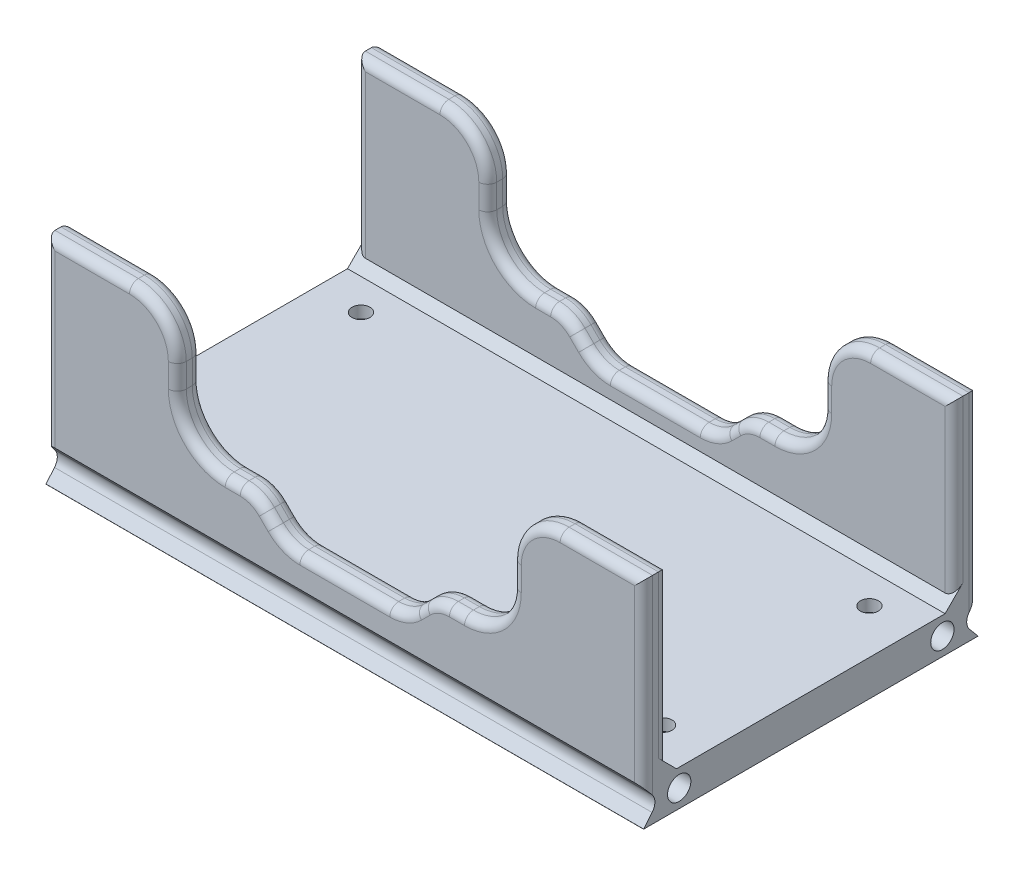
from build123d import *

# Parameters (mm, degrees)
SZKIC1_W                    = 99.9
SZKIC1_H                    = 55.9
DODANIE_WYCI_GNI_CIE1_DEPTH = 6
SZKIC2_R                    = 1.5
WYTNIJ_WYCI_GNI_CIE1_DEPTH  = 58.551759313
SZKIC3_R                    = 3.5
WYTNIJ_WYCI_GNI_CIE2_DEPTH  = 4
WYTNIJ_WYCI_GNI_CIE6_DEPTH  = 104.909636223
ZAOKR_GLENIE3_R             = 2
ZAOKR_GLENIE3_OF_LUSTRO2_R  = 2
SZKIC6_R                    = 2
WYTNIJ_WYCI_GNI_CIE3_DEPTH  = 1
ZAOKR_GLENIE2_R             = 2
SZKIC9_W                    = 99.9
SZKIC9_H                    = 4
DODANIE_WYCI_GNI_CIE2_DEPTH = 30
SFAZOWANIE2_SIZE            = 1.5
WYTNIJ_WYCI_GNI_CIE8_REACH  = 85.161
SZKIC10_W                   = 56
SZKIC10_H                   = 20
SZYK_KO_OWY1_COUNT          = 2
ZAOKR_GLENIE4_R             = 8
WYTNIJ_WYCI_GNI_CIE9_DEPTH  = 84.161364286
ZAOKR_GLENIE5_R             = 6
SFAZOWANIE3_SIZE            = 2
SZKIC7_R                    = 1.95
WYTNIJ_WYCI_GNI_CIE7_DEPTH  = 5.8
ZAOKR_GLENIE6_R             = 1.5


# Some blends are built 0.0001 mm under size
with BuildPart() as part:
    # Szkic1 → Dodanie-wyciągnięcie1 (new body)
    with BuildSketch(Plane(origin=(0, 0, 0), x_dir=(1, 0, 0), z_dir=(0, 1, 0))):
        Rectangle(SZKIC1_W, SZKIC1_H)
    extrude(amount=DODANIE_WYCI_GNI_CIE1_DEPTH)

    # Szkic2 → Wytnij-wyciągnięcie1 (cut, through all)
    with BuildSketch(Plane(origin=(0, 6, 0), x_dir=(1, 0, 0), z_dir=(0, 1, 0))):
        with Locations(Location((-42.5, 17.25, 0), (0, 0, 270))):
            Circle(SZKIC2_R)
        with Locations(Location((-42.5, -17.25, 0), (0, 0, 270))):
            Circle(SZKIC2_R)
        with Locations(Location((42.5, -17.25, 0), (0, 0, 270))):
            Circle(SZKIC2_R)
        with Locations(Location((42.5, 17.25, 0), (0, 0, 270))):
            Circle(SZKIC2_R)
    extrude(amount=-WYTNIJ_WYCI_GNI_CIE1_DEPTH, mode=Mode.SUBTRACT)

    # Szkic3 → Wytnij-wyciągnięcie2 (cut)
    with BuildSketch(Plane.XZ):
        with Locations(Location((-42.5, 17.25, 0), (0, 0, 270))):
            Circle(SZKIC3_R)
        with Locations(Location((-42.5, -17.25, 0), (0, 0, 270))):
            Circle(SZKIC3_R)
        with Locations(Location((42.5, 17.25, 0), (0, 0, 270))):
            Circle(SZKIC3_R)
        with Locations(Location((42.5, -17.25, 0), (0, 0, 270))):
            Circle(SZKIC3_R)
    extrude(amount=-WYTNIJ_WYCI_GNI_CIE2_DEPTH, mode=Mode.SUBTRACT)

    # Szkic5 → Wytnij-wyciągnięcie6 (cut, through all)
    with BuildSketch(Plane.ZY.offset(49.95)):
        Polygon((-27.95, 0.020616019), (-27.95, 5.979383981), (-25.45, 3), align=None)
    wytnij_wyci_gni_cie6 = extrude(amount=-WYTNIJ_WYCI_GNI_CIE6_DEPTH, mode=Mode.SUBTRACT)

    # Zaokrąglenie3
    zaokr_glenie3_edges = [part.edges().sort_by_distance(p)[0] for p in [
        (0, 3, -25.45),
    ]]
    fillet(zaokr_glenie3_edges, radius=ZAOKR_GLENIE3_R)

    # Lustro2: Wytnij-wyciągnięcie6 across plane
    add(wytnij_wyci_gni_cie6.mirror(Plane.XY), mode=Mode.SUBTRACT)

    # Zaokrąglenie3 of Lustro2
    zaokr_glenie3_of_lustro2_edges = [part.edges().sort_by_distance(p)[0] for p in [
        (0, 3, 25.45),
    ]]
    fillet(zaokr_glenie3_of_lustro2_edges, radius=ZAOKR_GLENIE3_OF_LUSTRO2_R)

    # Szkic6 → Wytnij-wyciągnięcie3 (cut)
    with BuildSketch(Plane.ZY.offset(49.95)):
        with Locations((0, 3)):
            Circle(SZKIC6_R)
    extrude(amount=-WYTNIJ_WYCI_GNI_CIE3_DEPTH, mode=Mode.SUBTRACT)

    # Zaokrąglenie2
    # the kernel refuses this fillet: 2 mm, written as the material it adds along each edge
    with BuildSketch(Plane(origin=(-48.95, 3, 0), x_dir=(0, 0, 1), z_dir=(0, -1, 0))) as zaokr_glenie2_piece_1:
        with BuildLine():
            CenterArc((0.267949192, 2), ZAOKR_GLENIE2_R, 270, 60)
            Line((0.267949192, 0), (0.267949192, -0.04))
            Line((0.267949192, -0.04), (2, -0.04))
            Line((2, -0.04), (2.04, 0))
            ThreePointArc((2.04, 0), (2.04, 0.5), (2.034641016, 0.98))
            Line((2.034641016, 0.98), (2, 1))
        make_face()
    revolve(axis=Axis((-48.95, 3, 0), (-1, 0, 0)))

    # Szkic9 → Dodanie-wyciągnięcie2 (add)
    with BuildSketch(Plane(origin=(0, 6, 0), x_dir=(1, 0, 0), z_dir=(0, 1, 0))):
        with Locations((0, 25.95)):
            Rectangle(SZKIC9_W, SZKIC9_H)
        with Locations((0, -25.95)):
            Rectangle(SZKIC9_W, SZKIC9_H)
    extrude(amount=DODANIE_WYCI_GNI_CIE2_DEPTH)

    # Sfazowanie2
    sfazowanie2_edges = [part.edges().sort_by_distance(p)[0] for p in [
        (0, 6, -23.95),
        (0, 6, 23.95),
    ]]
    chamfer(sfazowanie2_edges, length=SFAZOWANIE2_SIZE)

    # Szkic10 → Wytnij-wyciągnięcie8 (cut, up to next)
    with BuildSketch(Plane(origin=(0, 0, 27.95), x_dir=(-1, 0, 0), z_dir=(0, 0, -1)), mode=Mode.PRIVATE) as wytnij_wyci_gni_cie8_sk1:
        with Locations((0, 26)):
            Rectangle(SZKIC10_W, SZKIC10_H)
    wytnij_wyci_gni_cie8_tool1 = extrude(wytnij_wyci_gni_cie8_sk1.sketch, amount=WYTNIJ_WYCI_GNI_CIE8_REACH, mode=Mode.PRIVATE) & part.part
    wytnij_wyci_gni_cie8 = wytnij_wyci_gni_cie8_tool1.solids().sort_by_distance((0, 26, 27.95))[0]
    add(wytnij_wyci_gni_cie8, mode=Mode.SUBTRACT)

    # Szyk kołowy1: Wytnij-wyciągnięcie8 ×2 about axis
    szyk_ko_owy1_axis = Axis((0, -1.3, 0), (0, 1, 0))
    for i in range(1, SZYK_KO_OWY1_COUNT):
        add(wytnij_wyci_gni_cie8.rotate(szyk_ko_owy1_axis, i * 360 / SZYK_KO_OWY1_COUNT), mode=Mode.SUBTRACT)

    # Zaokrąglenie4
    zaokr_glenie4_edges = [part.edges().sort_by_distance(p)[0] for p in [
        (28, 36, 25.95),
        (-28, 36, 25.95),
        (-28, 16, 25.95),
        (28, 16, 25.95),
        (-28, 16, -25.95),
        (28, 16, -25.95),
        (28, 36, -25.95),
        (-28, 36, -25.95),
    ]]
    fillet(zaokr_glenie4_edges, radius=ZAOKR_GLENIE4_R)

    # Szkic11 → Wytnij-wyciągnięcie9 (cut, through all)
    with BuildSketch(Plane(origin=(0, 0, -27.95), x_dir=(-1, 0, 0), z_dir=(0, 0, -1))):
        Polygon((-10, 11), (10, 11), (15, 16), (-15, 16), align=None)
    extrude(amount=-WYTNIJ_WYCI_GNI_CIE9_DEPTH, mode=Mode.SUBTRACT)

    # Zaokrąglenie5
    zaokr_glenie5_edges = [part.edges().sort_by_distance(p)[0] for p in [
        (15, 16, -25.95),
        (-15, 16, -25.95),
        (-10, 11, -25.95),
        (-10, 11, 25.95),
        (15, 16, 25.95),
        (-15, 16, 25.95),
        (10, 11, -25.95),
        (10, 11, 25.95),
    ]]
    fillet(zaokr_glenie5_edges, radius=ZAOKR_GLENIE5_R)

    # Sfazowanie3
    sfazowanie3_edges = [part.edges().sort_by_distance(p)[0] for p in [
        (-42.5, 4, -13.75),
        (42.5, 4, 20.75),
        (42.5, 4, -13.75),
        (-42.5, 4, 20.75),
    ]]
    chamfer(sfazowanie3_edges, length=SFAZOWANIE3_SIZE - 0.0001)  # a hair under: the kernel refuses the full size

    # Szkic7 → Wytnij-wyciągnięcie7 (cut)
    with BuildSketch(Plane(origin=(49.95, 0, 0), x_dir=(0, 0, -1), z_dir=(1, 0, 0))):
        with Locations((-22, 3)):
            Circle(SZKIC7_R)
        with Locations(Location((22, 3, 0), (0, 0, 211.461356155))):
            Circle(SZKIC7_R)
    extrude(amount=-WYTNIJ_WYCI_GNI_CIE7_DEPTH, mode=Mode.SUBTRACT)

    # Zaokrąglenie6
    zaokr_glenie6_edges = [part.edges().sort_by_distance(p)[0] for p in [
        (49.95, 21.75, -23.95),
        (-49.95, 21.75, -23.95),
        (42.975, 36, -27.95),
        (-42.975, 36, -23.95),
        (49.95, 21.75, 23.95),
        (-49.95, 21.75, 23.95),
        (42.975, 36, 23.95),
        (-42.975, 36, 27.95),
        (-28, 26, -27.95),
        (-28, 26, -23.95),
        (-18.742640687, 16, -27.95),
        (18.742640687, 16, -23.95),
        (-42.975, 36, -27.95),
        (28, 26, -27.95),
        (30.343145751, 33.656854249, -27.95),
        (-30.343145751, 33.656854249, -27.95),
        (28, 26, -23.95),
        (42.975, 36, -23.95),
        (30.343145751, 33.656854249, -23.95),
        (-30.343145751, 33.656854249, -23.95),
        (18.742640687, 16, 27.95),
        (-18.742640687, 16, 23.95),
        (-28, 26, 27.95),
        (-28, 26, 23.95),
        (28, 26, 27.95),
        (28, 26, 23.95),
        (42.975, 36, 27.95),
        (-30.343145751, 33.656854249, 27.95),
        (30.343145751, 33.656854249, 27.95),
        (-42.975, 36, 23.95),
        (-30.343145751, 33.656854249, 23.95),
        (30.343145751, 33.656854249, 23.95),
        (-25.656854249, 18.343145751, -27.95),
        (-25.656854249, 18.343145751, -23.95),
        (25.656854249, 18.343145751, -27.95),
        (25.656854249, 18.343145751, -23.95),
        (-25.656854249, 18.343145751, 27.95),
        (-25.656854249, 18.343145751, 23.95),
        (25.656854249, 18.343145751, 27.95),
        (25.656854249, 18.343145751, 23.95),
        (0, 11, 27.95),
        (0, 11, 23.95),
        (12.5, 13.5, 27.95),
        (12.5, 13.5, 23.95),
        (-12.5, 13.5, 23.95),
        (18.742640687, 16, 23.95),
        (-15.18918078, 15.543277195, 23.95),
        (15.18918078, 15.543277195, 23.95),
        (-12.5, 13.5, 27.95),
        (-18.742640687, 16, 27.95),
        (-15.18918078, 15.543277195, 27.95),
        (15.18918078, 15.543277195, 27.95),
        (-12.5, 13.5, -27.95),
        (-12.5, 13.5, -23.95),
        (0, 11, -23.95),
        (-18.742640687, 16, -23.95),
        (12.5, 13.5, -23.95),
        (15.18918078, 15.543277195, -23.95),
        (-15.18918078, 15.543277195, -23.95),
        (0, 11, -27.95),
        (12.5, 13.5, -27.95),
        (18.742640687, 16, -27.95),
        (15.18918078, 15.543277195, -27.95),
        (-15.18918078, 15.543277195, -27.95),
        (9.81081922, 11.456722805, 23.95),
        (9.81081922, 11.456722805, 27.95),
        (-9.81081922, 11.456722805, 23.95),
        (-9.81081922, 11.456722805, 27.95),
        (-9.81081922, 11.456722805, -27.95),
        (-9.81081922, 11.456722805, -23.95),
        (9.81081922, 11.456722805, -27.95),
        (9.81081922, 11.456722805, -23.95),
        (49.95, 20.989691991, 27.95),
        (-49.95, 20.989691991, 27.95),
        (-49.95, 20.989691991, -27.95),
        (49.95, 20.989691991, -27.95),
    ]]
    fillet(zaokr_glenie6_edges, radius=ZAOKR_GLENIE6_R)


solid = part.part
